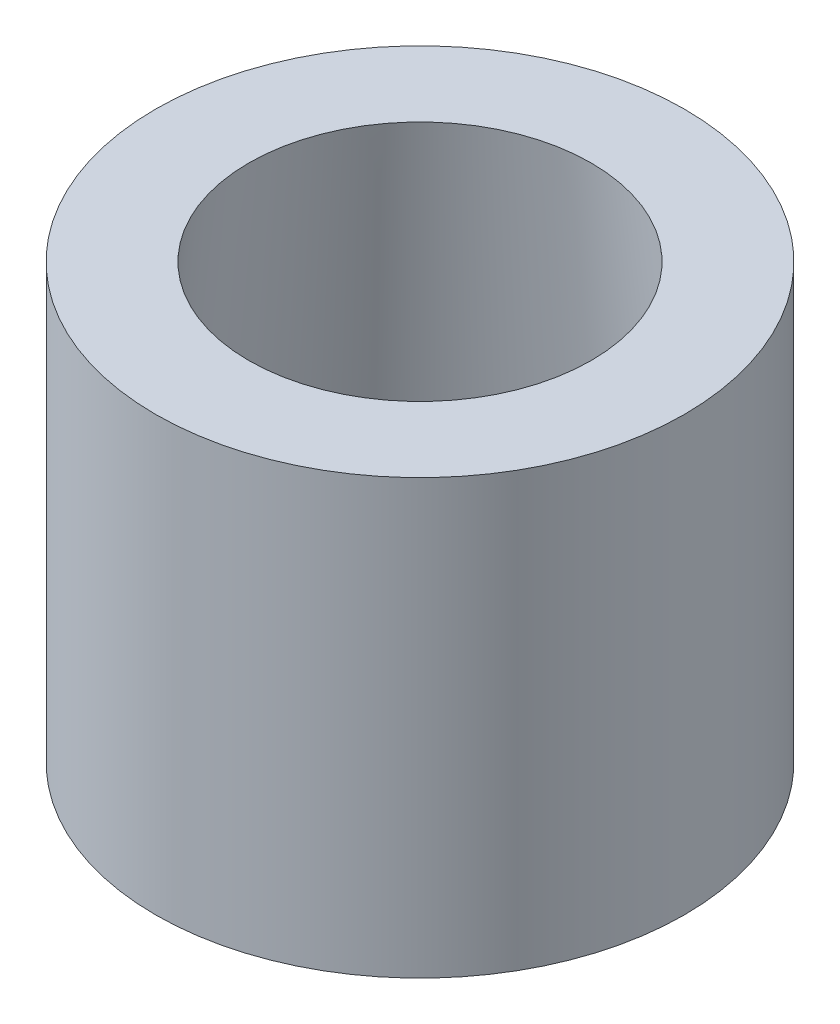
from build123d import *

# Parameters (mm, degrees)
SKETCH1_R           = 30.5
BOSS_EXTRUDE1_DEPTH = 50
SKETCH3_R           = 25
CUT_EXTRUDE8_DEPTH  = 67.034082109
CUT_EXTRUDE8_DRAFT  = -6
FILLET1_R           = 4


with BuildPart() as part:
    # Sketch1 → Boss-Extrude1 (new body)
    with BuildSketch(Plane(origin=(0, 0, 0), x_dir=(1, 0, 0), z_dir=(0, 1, 0))):
        Circle(SKETCH1_R)
    extrude(amount=BOSS_EXTRUDE1_DEPTH)


with BuildPart() as cut_extrude8_tool:
    # Sketch3 → Cut-Extrude8 (with draft: the straight prism first)
    with BuildSketch(Plane(origin=(0, 0, 0), x_dir=(-1, 0, 0), z_dir=(0, -1, 0))):
        Circle(SKETCH3_R)
    extrude(amount=-CUT_EXTRUDE8_DEPTH)
    # Cut-Extrude8: the draft: its side faces are tilted about the plane it starts from
    cut_extrude8_sides = [cut_extrude8_tool.faces().sort_by_distance(p)[0] for p in [
        (25, 33.517041055, 0),
    ]]
    draft(cut_extrude8_sides, Plane(origin=(0, 0, 0), x_dir=(-1, 0, 0), z_dir=(0, -1, 0)), CUT_EXTRUDE8_DRAFT)


with BuildPart() as part_1:
    add(part.part)

    # Cut-Extrude8: cut by cut_extrude8_tool
    add(cut_extrude8_tool.part, mode=Mode.SUBTRACT)

    # Fillet1
    fillet1_edges = [part_1.edges().sort_by_distance(p)[0] for p in [
        (25, 0, 0),
    ]]
    fillet(fillet1_edges, radius=FILLET1_R)


solid = part_1.part
